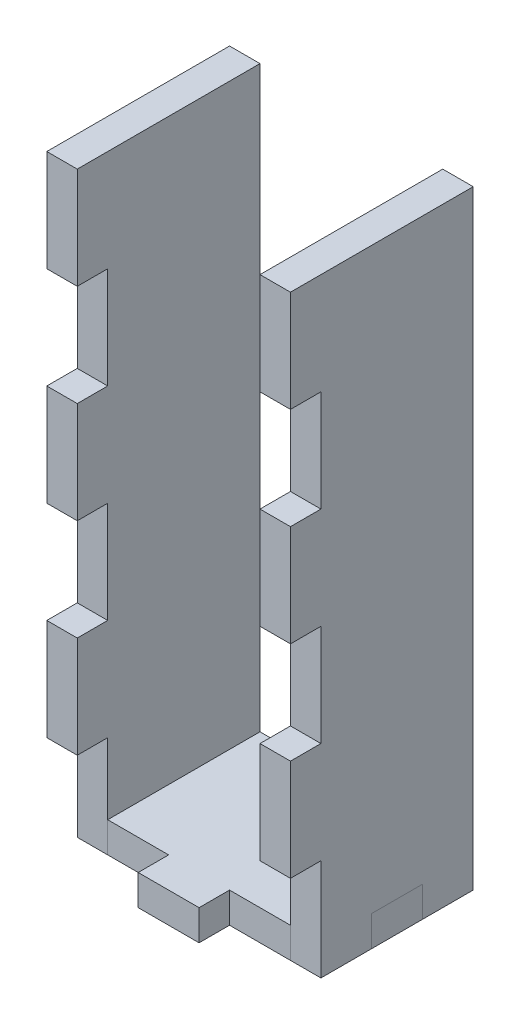
from build123d import *

# Parameters (mm, degrees)
SKETCH1_W           = 30.48
SKETCH1_H           = 25.4
BOSS_EXTRUDE1_DEPTH = 5.08
SKETCH2_W           = 8.466666666
SKETCH2_H           = 5.08
BOSS_EXTRUDE2_DEPTH = 5.08
SKETCH3_W           = 8.466666666
SKETCH3_H           = 5.08
BOSS_EXTRUDE3_DEPTH = 5.08
SKETCH4_W           = 25.4
SKETCH4_H           = 101.6
BOSS_EXTRUDE4_DEPTH = 5.08
SKETCH5_W           = 5.08
SKETCH5_H           = 8.466666666
CUT_EXTRUDE1_DEPTH  = 5.08
CIRPATTERN1_COUNT   = 2
SKETCH6_W           = 10.16
SKETCH6_H           = 5.08
BOSS_EXTRUDE5_DEPTH = 5.08
SKETCH7_W           = 5.08
SKETCH7_H           = 16.933333334
SKETCH7_H_2         = 16.933333333
BOSS_EXTRUDE6_DEPTH = 5.08
SKETCH8_W           = 5.08
SKETCH8_H           = 16.933333334
SKETCH8_H_2         = 16.933333333
BOSS_EXTRUDE7_DEPTH = 5.08


with BuildPart() as part:
    # Sketch1 → Boss-Extrude1 (new body)
    with BuildSketch(Plane(origin=(0, 0, 0), x_dir=(1, 0, 0), z_dir=(0, 1, 0))):
        with Locations((-15.24, 12.7)):
            Rectangle(SKETCH1_W, SKETCH1_H)
    extrude(amount=BOSS_EXTRUDE1_DEPTH)

    # Sketch2 → Boss-Extrude2 (add)
    with BuildSketch(Plane(origin=(0, 0, 0), x_dir=(0, 0, -1), z_dir=(1, 0, 0))):
        with Locations((12.7, 2.54)):
            Rectangle(SKETCH2_W, SKETCH2_H)
    extrude(amount=BOSS_EXTRUDE2_DEPTH)

    # Sketch3 → Boss-Extrude3 (add)
    with BuildSketch(Plane.ZY.offset(30.48)):
        with Locations((-12.7, 2.54)):
            Rectangle(SKETCH3_W, SKETCH3_H)
    extrude(amount=BOSS_EXTRUDE3_DEPTH)

    # Sketch6 → Boss-Extrude5 (add)
    with BuildSketch(Plane.XY):
        with Locations((-15.24, 2.54)):
            Rectangle(SKETCH6_W, SKETCH6_H)
    extrude(amount=BOSS_EXTRUDE5_DEPTH)


with BuildPart() as body_2:
    # Sketch4 → Boss-Extrude4 (new body)
    with BuildSketch(Plane(origin=(5.08, 0, 0), x_dir=(0, 0, -1), z_dir=(1, 0, 0))):
        with Locations((12.7, 50.8)):
            Rectangle(SKETCH4_W, SKETCH4_H)
    extrude(amount=BOSS_EXTRUDE4_DEPTH)

    # Sketch5 → Cut-Extrude1 (cut)
    with BuildSketch(Plane(origin=(0, 0, 0), x_dir=(-1, 0, 0), z_dir=(0, -1, 0))):
        with Locations((-7.62, 12.7)):
            Rectangle(SKETCH5_W, SKETCH5_H)
    extrude(amount=-CUT_EXTRUDE1_DEPTH, mode=Mode.SUBTRACT)


with BuildPart() as body_2_1:
    # Body-Move/Copy1: read off the stored shape, not the designer's step
    # Body-Move/Copy1: moved
    add(body_2.part.moved(Location((-5.08, 0, 0))))


with BuildPart() as cirpattern1_1:
    # CirPattern1: pattern copy
    add(body_2_1.part.rotate(Axis((-15.24, 0, -12.7), (0, 1, 0)), 1 * 360 / CIRPATTERN1_COUNT))

    # Sketch7 → Boss-Extrude6 (add)
    with BuildSketch(Plane.XY):
        with Locations((-33.02, 25.4)):
            Rectangle(SKETCH7_W, SKETCH7_H)
        with Locations((-33.02, 59.266666667)):
            Rectangle(SKETCH7_W, SKETCH7_H_2)
        with Locations((-33.02, 93.133333334)):
            Rectangle(SKETCH7_W, SKETCH7_H_2)
    extrude(amount=BOSS_EXTRUDE6_DEPTH)


with BuildPart() as body_2_2:
    add(body_2_1.part)

    # Sketch8 → Boss-Extrude7 (add)
    with BuildSketch(Plane.XY):
        with Locations((2.54, 25.4)):
            Rectangle(SKETCH8_W, SKETCH8_H)
        with Locations((2.54, 59.266666667)):
            Rectangle(SKETCH8_W, SKETCH8_H_2)
        with Locations((2.54, 93.133333334)):
            Rectangle(SKETCH8_W, SKETCH8_H_2)
    extrude(amount=BOSS_EXTRUDE7_DEPTH)


solid = Compound([part.part, cirpattern1_1.part, body_2_2.part])
